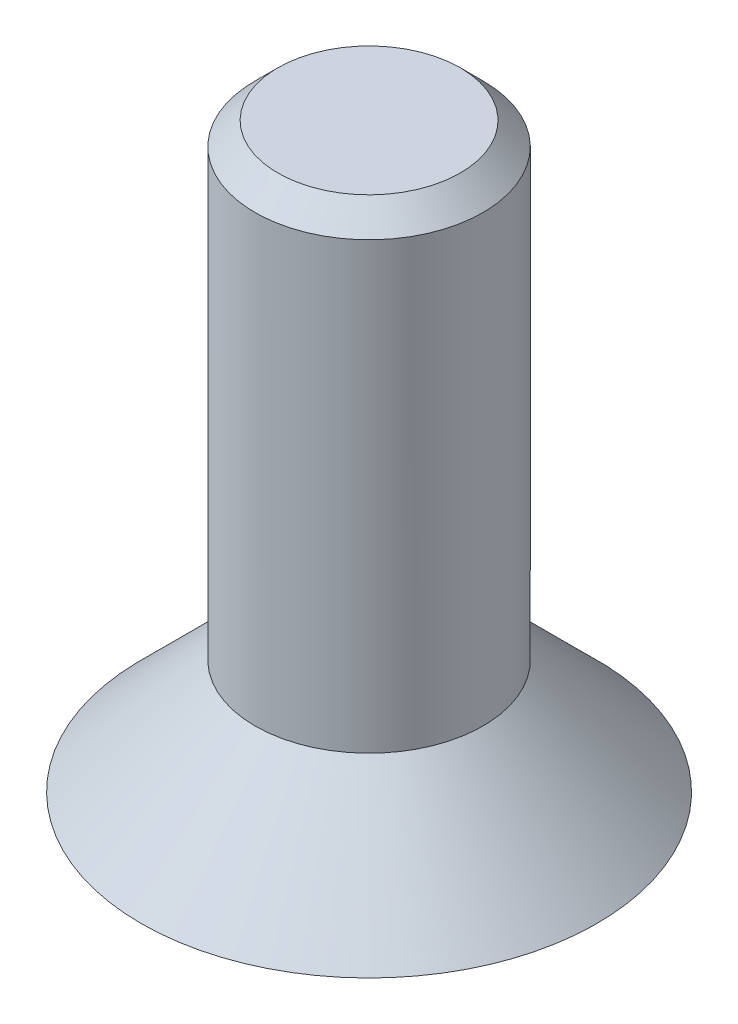
from build123d import *

# Parameters (mm, degrees)
SKETCH_1_R      = 2
EXTRUDE_1_DEPTH = 1
CHAMFER_1_SIZE  = 1
SKETCH_2_R      = 1
EXTRUDE_2_DEPTH = 4.1
CHAMFER_2_SIZE  = 0.2


with BuildPart() as part:
    # 草图1 → 凸台-拉伸1 (new body)
    with BuildSketch(Plane(origin=(0, 0, 0), x_dir=(1, 0, 0), z_dir=(0, 1, 0))):
        with Locations(Location((0, 0, 0), (0, 0, 270))):
            Circle(SKETCH_1_R)
        Polygon((0, -0.866025404), (0.75, -0.433012702), (0.75, 0.433012702), (0, 0.866025404), (-0.75, 0.433012702), (-0.75, -0.433012702), align=None, mode=Mode.SUBTRACT)
    extrude(amount=EXTRUDE_1_DEPTH)

    # 倒角1
    # the kernel refuses this chamfer: 1 mm, written as the material it takes off along each edge
    with BuildSketch(Plane(origin=(0, 1, 0), x_dir=(0, 0, 1), z_dir=(-1, 0, 0))) as chamfer_1_piece_1:
        Polygon((2, -CHAMFER_1_SIZE), (2 - CHAMFER_1_SIZE, 0), (2, 0), align=None)
    revolve(axis=Axis((0, 1, 0), (0, 1, 0)), mode=Mode.SUBTRACT)

    # 草图2 → 凸台-拉伸2 (add)
    with BuildSketch(Plane(origin=(0, 1, 0), x_dir=(1, 0, 0), z_dir=(0, 1, 0))):
        with Locations(Location((0, 0, 0), (0, 0, 270))):
            Circle(SKETCH_2_R)
    extrude(amount=EXTRUDE_2_DEPTH)

    # 倒角2
    chamfer_2_edges = [part.edges().sort_by_distance(p)[0] for p in [
        (0, 5.1, -1),
    ]]
    chamfer(chamfer_2_edges, length=CHAMFER_2_SIZE)


solid = part.part
